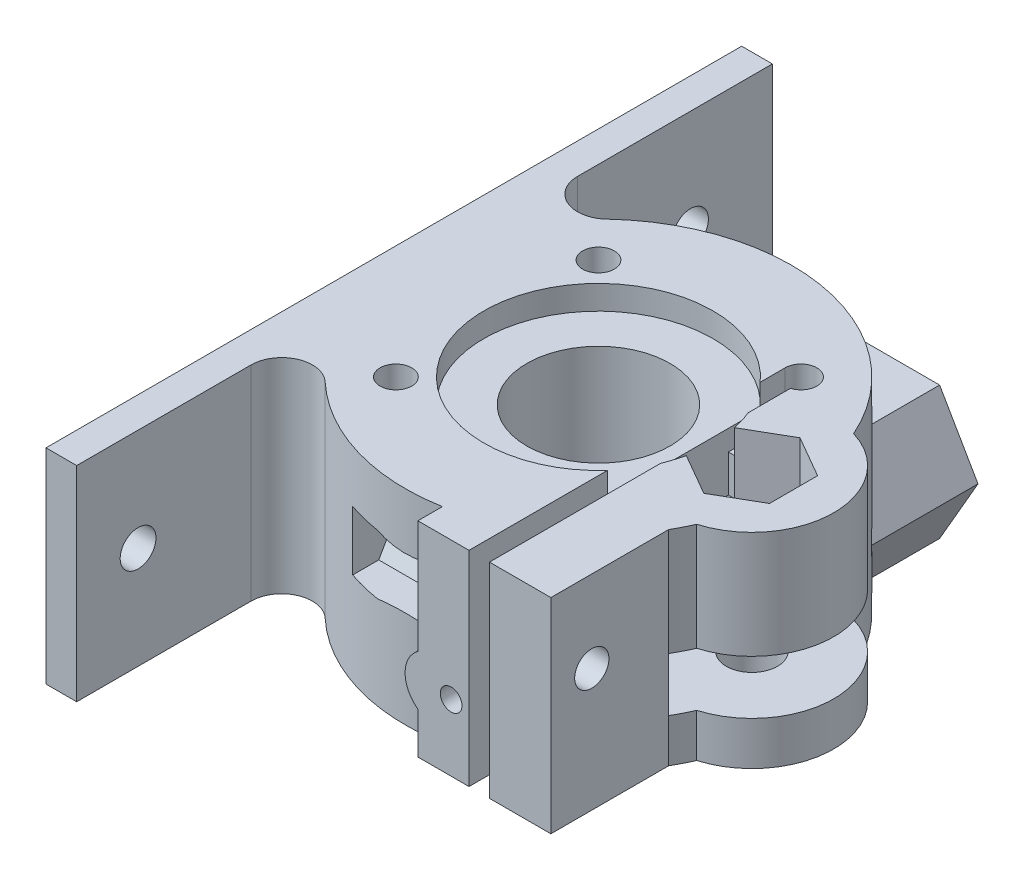
from build123d import *

# Parameters (mm, degrees)
SKETCH1_R                = 1.55
SKETCH1_R_2              = 7
SKETCH1_R_3              = 2.5
BOSS_EXTRUDE1_DEPTH      = 20
BOSS_EXTRUDE2_REACH      = 53.813
BOSS_EXTRUDE2_END_RADIUS = 18.9
BOSS_EXTRUDE3_REACH      = 55.526
BOSS_EXTRUDE3_END_RADIUS = 18.9
SKETCH3_W                = 6
SKETCH3_H                = 20
SKETCH5_R                = 1.675
CUT_EXTRUDE3_DEPTH       = 22.5
CUT_EXTRUDE4_DEPTH       = 11
CUT_EXTRUDE5_DEPTH       = 5.25
SKETCH8_R                = 1.06
CUT_EXTRUDE6_DEPTH       = 54.525694884
SKETCH9_R                = 3
CUT_EXTRUDE7_DEPTH       = 10
SKETCH11_R               = 11.2
CUT_EXTRUDE9_DEPTH       = 2.35
CUT_EXTRUDE8_DEPTH       = 6
SKETCH15_W               = 3
SKETCH15_H               = 68
BOSS_EXTRUDE5_DEPTH      = 20
FILLET2_R                = 3
CUT_EXTRUDE11_REACH      = 61.674
SKETCH16_R               = 1.75


with BuildPart() as part:
    # Sketch1 → Boss-Extrude1 (new body)
    with BuildSketch(Plane(origin=(0, 0, 0), x_dir=(1, 0, 0), z_dir=(0, 1, 0))):
        with BuildLine():
            Line((10.349494937, -15.814485593), (10.349494937, 8.416255239))
            ThreePointArc((10.349494937, 8.416255239), (10.822804202, 11.144484896), (8.349494937, 9.899494937))
            Line((8.349494937, 9.899494937), (8.349494937, -16.955705067))
            ThreePointArc((8.349494937, -16.955705067), (-17.76919177, 6.439396233), (17.273666667, 7.670100383))
            ThreePointArc((17.273666667, 7.670100383), (23, 0), (17.273666667, -7.670100383))
            ThreePointArc((17.273666667, -7.670100383), (14.399392933, -12.242037541), (10.349494937, -15.814485593))
        make_face()
        with Locations(Location((-9.899494937, 9.899494937, 0), (0, 0, 270))):
            Circle(SKETCH1_R, mode=Mode.SUBTRACT)
        with Locations(Location((-9.899494937, -9.899494937, 0), (0, 0, 270))):
            Circle(SKETCH1_R, mode=Mode.SUBTRACT)
        with Locations(Location((0, 0, 0), (0, 0, 270))):
            Circle(SKETCH1_R_2, mode=Mode.SUBTRACT)
        with Locations(Location((15, 0, 0), (0, 0, 270))):
            Circle(SKETCH1_R_3, mode=Mode.SUBTRACT)
    extrude(amount=BOSS_EXTRUDE1_DEPTH)

    # Boss-Extrude2: up to this cylinder (the profile starts outside it)
    boss_extrude2_end = Plane(origin=(0, 6.495191, 0), z_dir=(0, -1, 0)) * Cylinder(BOSS_EXTRUDE2_END_RADIUS, 146.426, mode=Mode.PRIVATE)
    # Sketch2 → Boss-Extrude2 (add, up to the surface)
    with BuildSketch(Plane.XY.offset(-23), mode=Mode.PRIVATE) as boss_extrude2_sk1:
        Polygon((14.1, 6.495190528), (10.35, 0), (2.85, 0), (-0.9, 6.495190528), (2.85, 12.990381057), (10.35, 12.990381057), align=None)
    boss_extrude2_tool1 = extrude(boss_extrude2_sk1.sketch, amount=BOSS_EXTRUDE2_REACH, mode=Mode.PRIVATE) - boss_extrude2_end
    add(boss_extrude2_tool1.solids().sort_by_distance((6.6, 6.495191, -23))[0])

    # Boss-Extrude3: up to this cylinder (the profile starts outside it)
    boss_extrude3_end = Plane(origin=(0, 9.928375, 0), z_dir=(0, -1, 0)) * Cylinder(BOSS_EXTRUDE3_END_RADIUS, 149.99525, mode=Mode.PRIVATE)
    # Sketch3 → Boss-Extrude3 (add, up to the surface)
    with BuildSketch(Plane.XY.offset(21), mode=Mode.PRIVATE) as boss_extrude3_sk1:
        with BuildLine():
            Line((8.349494937, 20), (3.349494937, 20))
            Line((3.349494937, 20), (3.349494937, 8.936698586))
            ThreePointArc((3.349494937, 8.936698586), (2.099494937, 6.5), (3.349494937, 4.063301414))
            Line((3.349494937, 4.063301414), (3.349494937, 0))
            Line((3.349494937, 0), (8.349494937, 0))
            Line((8.349494937, 0), (8.349494937, 20))
        make_face()
    boss_extrude3_tool1 = extrude(boss_extrude3_sk1.sketch, amount=-BOSS_EXTRUDE3_REACH, mode=Mode.PRIVATE) - boss_extrude3_end
    add(boss_extrude3_tool1.solids().sort_by_distance((5.726294, 9.85675, 21))[0])
    # Sketch3 → Boss-Extrude3 (add, up to the surface)
    with BuildSketch(Plane.XY.offset(21), mode=Mode.PRIVATE) as boss_extrude3_sk2:
        with Locations((13.349494937, 10)):
            Rectangle(SKETCH3_W, SKETCH3_H)
    boss_extrude3_tool2 = extrude(boss_extrude3_sk2.sketch, amount=-BOSS_EXTRUDE3_REACH, mode=Mode.PRIVATE) - boss_extrude3_end
    add(boss_extrude3_tool2.solids().sort_by_distance((13.349495, 10, 21))[0])

    # Sketch5 → Cut-Extrude3 (cut)
    with BuildSketch(Plane(origin=(16.349494937, 0, 0), x_dir=(0, 0, -1), z_dir=(1, 0, 0))):
        with Locations(Location((-17, 12, 0), (0, 0, 90))):
            Circle(SKETCH5_R)
    extrude(amount=-CUT_EXTRUDE3_DEPTH, mode=Mode.SUBTRACT)

    # Sketch6 → Cut-Extrude4 (cut)
    with BuildSketch(Plane(origin=(-6.150505063, 0, 0), x_dir=(0, 0, -1), z_dir=(1, 0, 0))):
        Polygon((-20.35, 12), (-18.675, 9.098814897), (-15.325, 9.098814897), (-13.65, 12), (-15.325, 14.901185103), (-18.675, 14.901185103), align=None)
    extrude(amount=CUT_EXTRUDE4_DEPTH, mode=Mode.SUBTRACT)

    # Sketch7 → Cut-Extrude5 (cut)
    with BuildSketch(Plane(origin=(0, 4.25, 0), x_dir=(1, 0, 0), z_dir=(0, 1, 0))):
        with BuildLine():
            Line((6.29798001, 4), (5.744562647, 4))
            Line((5.744562647, 4), (5.744562647, -4))
            Line((5.744562647, -4), (6.29798001, -4))
            ThreePointArc((6.29798001, -4), (24.577324882, 0), (6.29798001, 4))
        make_face()
    extrude(amount=CUT_EXTRUDE5_DEPTH, mode=Mode.SUBTRACT)

    # Sketch8 → Cut-Extrude6 (cut, through all)
    with BuildSketch(Plane(origin=(0, 0, -23), x_dir=(-1, 0, 0), z_dir=(0, 0, -1))):
        with Locations((-6.6, 6.495190528)):
            Circle(SKETCH8_R)
    extrude(amount=-CUT_EXTRUDE6_DEPTH, mode=Mode.SUBTRACT)

    # Sketch9 → Cut-Extrude7 (cut)
    with BuildSketch(Plane(origin=(0, 0, -23), x_dir=(-1, 0, 0), z_dir=(0, 0, -1))):
        with Locations((-6.6, 6.495190528)):
            Circle(SKETCH9_R)
    extrude(amount=-CUT_EXTRUDE7_DEPTH, mode=Mode.SUBTRACT)

    # Sketch11 → Cut-Extrude9 (cut)
    with BuildSketch(Plane(origin=(0, 20, 0), x_dir=(1, 0, 0), z_dir=(0, 1, 0))):
        Circle(SKETCH11_R)
    extrude(amount=-CUT_EXTRUDE9_DEPTH, mode=Mode.SUBTRACT)

    # Sketch10 → Cut-Extrude8 (cut)
    with BuildSketch(Plane(origin=(0, 20, 0), x_dir=(1, 0, 0), z_dir=(0, 1, 0))):
        Polygon((15, 4.7), (10.929680602, 2.35), (10.349494937, 2.35), (10.349494937, -2.35), (10.929680602, -2.35), (15, -4.7), (19.070319398, -2.35), (19.070319398, 2.35), align=None)
    extrude(amount=-CUT_EXTRUDE8_DEPTH, mode=Mode.SUBTRACT)

    # Cut-Revolve1: read off the stored shape, not the designer's step
    # Cut-Revolve1: loft between two sections, ruled curve by curve
    cut_revolve1_from = [
        Edge.make_three_point_arc((7.653578644, 6.608263478, -9.001288479), (6.491231459, 7.554083708, -9.001288479), (5.545411229, 6.391736522, -9.001288479)),
        Edge.make_three_point_arc((5.545411229, 6.391736522, -9.001288479), (6.707758415, 5.445916292, -9.001288479), (7.653578644, 6.608263478, -9.001288479)),
    ]
    cut_revolve1_to = [
        Edge.make_three_point_arc((9.086412031, 6.755427811, -4), (6.344067126, 8.986917094, -4), (4.112577842, 6.244572189, -4)),
        Edge.make_three_point_arc((4.112577842, 6.244572189, -4), (6.854922748, 4.013082906, -4), (9.086412031, 6.755427811, -4)),
    ]
    cut_revolve1 = Solid(Shell([*[Face.make_surface_from_curves(cut_revolve1_from[k], cut_revolve1_to[k]) for k in range(2)], Face(Wire(cut_revolve1_from)), Face(Wire(cut_revolve1_to))]))
    add(cut_revolve1, mode=Mode.SUBTRACT)

    # Sketch15 → Boss-Extrude5 (add)
    with BuildSketch(Plane(origin=(0, 0, 0), x_dir=(1, 0, 0), z_dir=(0, 1, 0))):
        with Locations((-19.5, 1)):
            Rectangle(SKETCH15_W, SKETCH15_H)
    extrude(amount=BOSS_EXTRUDE5_DEPTH)

    # Fillet2
    fillet2_edges = [part.edges().sort_by_distance(p)[0] for p in [
        (-18, 10, -5.762811814),
        (-18, 10, 5.762811814),
    ]]
    fillet(fillet2_edges, radius=FILLET2_R)

    # Sketch16 → Cut-Extrude11 (cut, up to next)
    with BuildSketch(Plane.ZY.offset(21), mode=Mode.PRIVATE) as cut_extrude11_sk1:
        with Locations((-27, 10)):
            Circle(SKETCH16_R)
    cut_extrude11_tool1 = extrude(cut_extrude11_sk1.sketch, amount=-CUT_EXTRUDE11_REACH, mode=Mode.PRIVATE) & part.part
    # Sketch16 → Cut-Extrude11 (cut, up to next)
    with BuildSketch(Plane.ZY.offset(21), mode=Mode.PRIVATE) as cut_extrude11_sk2:
        with Locations((27, 10)):
            Circle(SKETCH16_R)
    cut_extrude11_tool2 = extrude(cut_extrude11_sk2.sketch, amount=-CUT_EXTRUDE11_REACH, mode=Mode.PRIVATE) & part.part
    add(cut_extrude11_tool1.solids().sort_by_distance((-21, 10, -27))[0], mode=Mode.SUBTRACT)
    add(cut_extrude11_tool2.solids().sort_by_distance((-21, 10, 27))[0], mode=Mode.SUBTRACT)


solid = part.part
